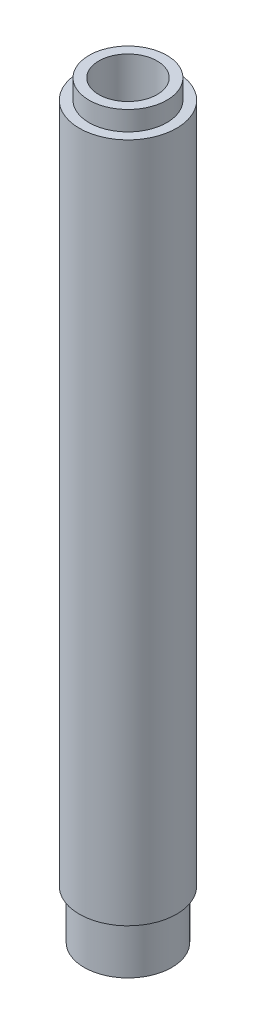
from build123d import *

# Parameters (mm, degrees)
SKETCH1_R           = 12.7
BOSS_EXTRUDE1_DEPTH = 177.8
SKETCH4_R           = 10.16
BOSS_EXTRUDE2_DEPTH = 5.08
SKETCH5_R           = 7.62
CUT_EXTRUDE1_DEPTH  = 184.759828036
SKETCH6_R           = 11.43
SKETCH6_R_2         = 7.62
BOSS_EXTRUDE3_DEPTH = 12.7


with BuildPart() as part:
    # Sketch1 → Boss-Extrude1 (new body)
    with BuildSketch(Plane(origin=(0, 0, 0), x_dir=(1, 0, 0), z_dir=(0, 1, 0))):
        Circle(SKETCH1_R)
    extrude(amount=BOSS_EXTRUDE1_DEPTH)

    # Sketch4 → Boss-Extrude2 (add)
    with BuildSketch(Plane(origin=(0, 177.8, 0), x_dir=(1, 0, 0), z_dir=(0, 1, 0))):
        Circle(SKETCH4_R)
    extrude(amount=BOSS_EXTRUDE2_DEPTH)

    # Sketch5 → Cut-Extrude1 (cut, through all)
    with BuildSketch(Plane(origin=(0, 182.88, 0), x_dir=(1, 0, 0), z_dir=(0, 1, 0))):
        Circle(SKETCH5_R)
    extrude(amount=-CUT_EXTRUDE1_DEPTH, mode=Mode.SUBTRACT)

    # Sketch6 → Boss-Extrude3 (add)
    with BuildSketch(Plane.XZ):
        Circle(SKETCH6_R)
        Circle(SKETCH6_R_2, mode=Mode.SUBTRACT)
    extrude(amount=BOSS_EXTRUDE3_DEPTH)


solid = part.part
